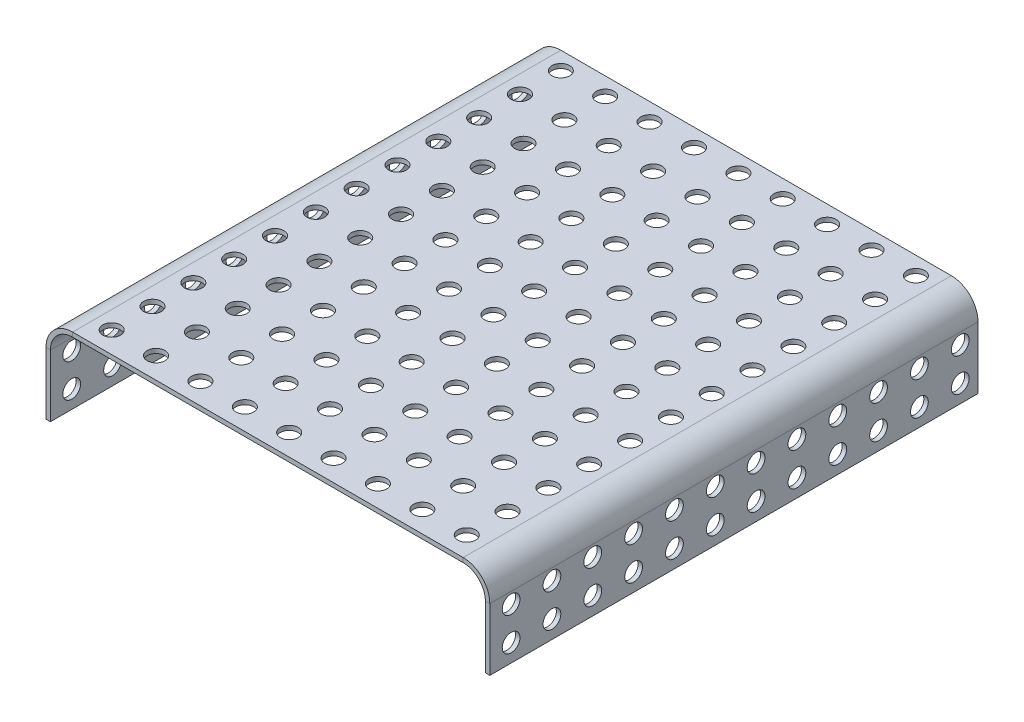
from build123d import *

# Parameters (mm, degrees)
BASE_FLANGE1_DEPTH   = 110
SKETCH6_R            = 2
CUT_EXTRUDE1_DEPTH   = 151
LPATTERN1_COUNT      = 2
LPATTERN1_PITCH      = 7.5
LPATTERN1_COUNT_DIR2 = 12
LPATTERN1_PITCH_DIR2 = 9.2
CUT_EXTRUDE2_REACH   = 124.474
SKETCH7_R            = 2
LPATTERN2_COUNT      = 9
LPATTERN2_PITCH      = 10
LPATTERN2_COUNT_DIR2 = 12
LPATTERN2_PITCH_DIR2 = 9.2


# Sheet-metal steps are written as plain solids
with BuildPart() as part:
    # Sketch1 → Base-Flange1 (new body)
    with BuildSketch(Plane.XY):
        with BuildLine():
            Line((-50, 0), (-50, 14))
            ThreePointArc((-50, 14), (-48.242640687, 18.242640687), (-44, 20))
            Line((-44, 20), (44, 20))
            ThreePointArc((44, 20), (48.242640687, 18.242640687), (50, 14))
            Line((50, 14), (50, 0))
            Line((50, 0), (49, 0))
            Line((49, 0), (49, 14))
            ThreePointArc((49, 14), (47.535533906, 17.535533906), (44, 19))
            Line((44, 19), (-44, 19))
            ThreePointArc((-44, 19), (-47.535533906, 17.535533906), (-49, 14))
            Line((-49, 14), (-49, 0))
            Line((-49, 0), (-50, 0))
        make_face()
    extrude(amount=BASE_FLANGE1_DEPTH)

    # Sketch6 → Cut-Extrude1 (cut, through all)
    with BuildSketch(Plane.ZY.offset(50)):
        with Locations((4, 4)):
            Circle(SKETCH6_R)
    cut_extrude1 = extrude(amount=-CUT_EXTRUDE1_DEPTH, mode=Mode.SUBTRACT)

    # LPattern1: Cut-Extrude1 2 × 12
    with Locations(*[(0, i * LPATTERN1_PITCH, j * LPATTERN1_PITCH_DIR2) for i in range(LPATTERN1_COUNT) for j in range(LPATTERN1_COUNT_DIR2) if (i, j) != (0, 0)]):
        add(cut_extrude1, mode=Mode.SUBTRACT)

    # Sketch7 → Cut-Extrude2 (cut, up to next)
    with BuildSketch(Plane(origin=(0, 20, 0), x_dir=(1, 0, 0), z_dir=(0, 1, 0)), mode=Mode.PRIVATE) as cut_extrude2_sk1:
        with Locations(Location((-40, -4, 0), (0, 0, 270))):
            Circle(SKETCH7_R)
    cut_extrude2_tool1 = extrude(cut_extrude2_sk1.sketch, amount=-CUT_EXTRUDE2_REACH, mode=Mode.PRIVATE) & part.part
    cut_extrude2 = cut_extrude2_tool1.solids().sort_by_distance((-40, 20, 4))[0]
    add(cut_extrude2, mode=Mode.SUBTRACT)

    # LPattern2: Cut-Extrude2 9 × 12
    with Locations(*[(i * LPATTERN2_PITCH, 0, j * LPATTERN2_PITCH_DIR2) for i in range(LPATTERN2_COUNT) for j in range(LPATTERN2_COUNT_DIR2) if (i, j) != (0, 0)]):
        add(cut_extrude2, mode=Mode.SUBTRACT)


solid = part.part
